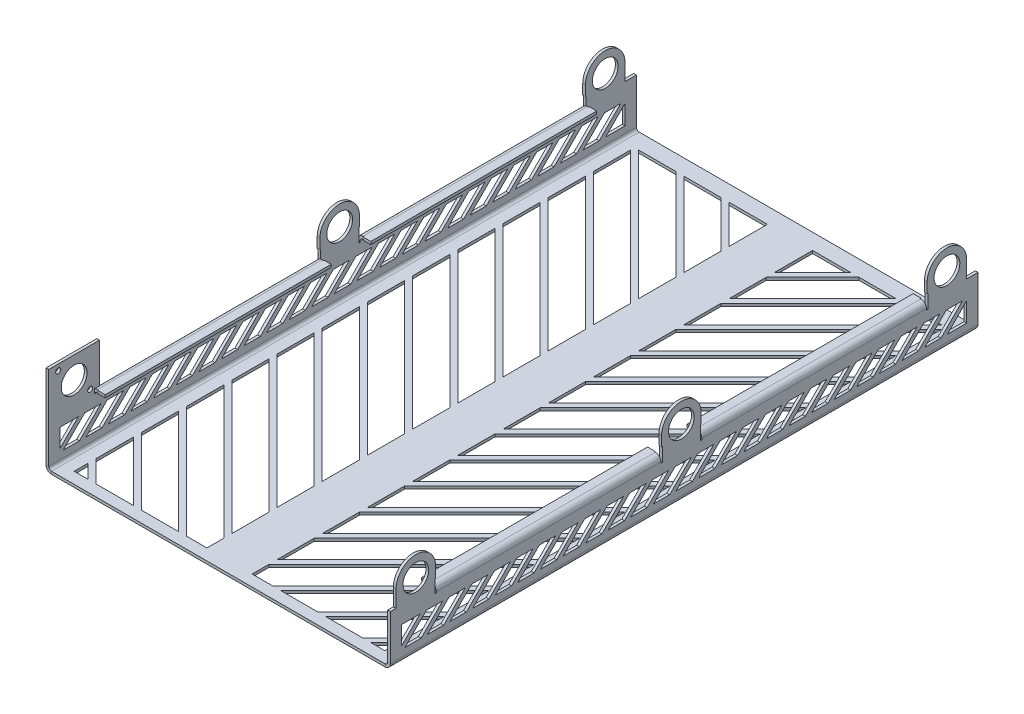
from build123d import *

# Parameters (mm, degrees)
EXTRUDE_THIN1_DEPTH          = 330.2
BOSS_EXTRUDE1_DEPTH          = 3.175
LPATTERN3_COUNT              = 3
LPATTERN3_PITCH              = 298.45
MIRROR5_COPY_1_DEPTH         = 3.175
MIRROR5_COPY_2_DEPTH         = 3.175
CUT_EXTRUDE3_START           = -3.048
SKETCH28_W                   = 380.746
SKETCH28_H                   = 50.8
SKETCH28_H_2                 = 44.45
CUT_EXTRUDE3_DEPTH           = 3.048
F_1_1_8_CLEARANCE_HOLE1_D    = 28.97124
CONVERT_SOLID4_START         = 50.8
CONVERT_SOLID4_DEPTH         = 45.2
CONVERT_SOLID4_2_OUTLINE_W   = 0.127
CONVERT_SOLID4_2_OUTLINE_H   = 44.45
CONVERT_SOLID4_2_OUTLINE_H_2 = 50.8
CONVERT_SOLID4_2_DEPTH       = 1.27312674
CONVERT_SOLID4_START_2       = -330.2
CONVERT_SOLID4_3_DEPTH       = 660.4
CONVERT_SOLID4_START_3       = -273.812
CONVERT_SOLID4_4_DEPTH       = 255.524
CONVERT_SOLID4_START_4       = 24.638
CONVERT_SOLID4_5_DEPTH       = 255.524
CONVERT_SOLID4_6_DEPTH       = 1.524
CONVERT_SOLID4_START_5       = -19.812
CONVERT_SOLID4_7_DEPTH       = 1.524
CONVERT_SOLID4_8_DEPTH       = 1.524
CONVERT_SOLID4_START_6       = 278.638
CONVERT_SOLID4_9_DEPTH       = 1.524
CONVERT_SOLID4_10_DEPTH      = 660.4
CONVERT_SOLID4_START_7       = -272.288
CONVERT_SOLID4_11_DEPTH      = 252.476
CONVERT_SOLID4_START_8       = 26.162
CONVERT_SOLID4_12_DEPTH      = 252.476
VENT1_START                  = -3.048
VENT1_DEPTH                  = 3.048
VENT2_START                  = 190.5
VENT2_DEPTH                  = 3.048
BOSS_EXTRUDE2_START          = -3.048
SKETCH43_W                   = 57.15
SKETCH43_H                   = 57.15
SKETCH43_R                   = 14.48562
BOSS_EXTRUDE2_DEPTH          = 3.048
F_10_CLEARANCE_HOLE1_REACH   = 520.058
F_10_CLEARANCE_HOLE1_BORE_R  = 2.8067


with BuildPart() as part:
    # Sketch13 → Extrude-Thin1 (new, symmetric)
    with BuildSketch(Plane.XY):
        Polygon((-177.8, 50.8), (-190.5, 50.8), (-190.5, 0), (190.5, 0), (190.5, 50.8), (177.8, 50.8), (177.8, 53.848), (193.548, 53.848), (193.548, -3.048), (-193.548, -3.048), (-193.548, 53.848), (-177.8, 53.848), align=None)
    extrude(amount=EXTRUDE_THIN1_DEPTH, both=True)

    # Sketch18 → Boss-Extrude1 (add)
    with BuildSketch(Plane.ZY.offset(193.548)):
        with BuildLine():
            Line((279.4, 53.848), (323.85, 53.848))
            Line((323.85, 53.848), (323.85, 72.898))
            ThreePointArc((323.85, 72.898), (301.625, 95.123), (279.4, 72.898))
            Line((279.4, 72.898), (279.4, 53.848))
        make_face()
    boss_extrude1 = extrude(amount=-BOSS_EXTRUDE1_DEPTH)

    # LPattern3: Boss-Extrude1 ×3
    with Locations(*[(0, 0, -i * LPATTERN3_PITCH) for i in range(1, LPATTERN3_COUNT)]):
        add(boss_extrude1)

    # Mirror5: Boss-Extrude1 across plane
    add(boss_extrude1.mirror(Plane(origin=(0, 0, 0), x_dir=(0, 0, 1), z_dir=(1, 0, 0))))

    # Mirror5 copy 1 sketch → Mirror5 copy 1 (add)
    with BuildSketch(Plane(origin=(193.548, 0, -298.45), x_dir=(0, 0, 1), z_dir=(1, 0, 0))):
        with BuildLine():
            Line((279.4, -53.848), (323.85, -53.848))
            Line((323.85, -53.848), (323.85, -72.898))
            ThreePointArc((323.85, -72.898), (301.625, -95.123), (279.4, -72.898))
            Line((279.4, -72.898), (279.4, -53.848))
        make_face()
    extrude(amount=-MIRROR5_COPY_1_DEPTH)

    # Mirror5 copy 2 sketch → Mirror5 copy 2 (add)
    with BuildSketch(Plane(origin=(193.548, 0, -596.9), x_dir=(0, 0, 1), z_dir=(1, 0, 0))):
        with BuildLine():
            Line((279.4, -53.848), (323.85, -53.848))
            Line((323.85, -53.848), (323.85, -72.898))
            ThreePointArc((323.85, -72.898), (301.625, -95.123), (279.4, -72.898))
            Line((279.4, -72.898), (279.4, -53.848))
        make_face()
    extrude(amount=-MIRROR5_COPY_2_DEPTH)

    # Sketch28 → Cut-Extrude3 (cut)
    with BuildSketch(Plane(origin=(0, 53.848, 0), x_dir=(1, 0, 0), z_dir=(0, 1, 0)).offset(CUT_EXTRUDE3_START)):
        with Locations((0, -304.8)):
            Rectangle(SKETCH28_W, SKETCH28_H)
        with Locations((0, -3.175)):
            Rectangle(SKETCH28_W, SKETCH28_H_2)
        with Locations((0, 295.275)):
            Rectangle(SKETCH28_W, SKETCH28_H_2)
    extrude(amount=CUT_EXTRUDE3_DEPTH, mode=Mode.SUBTRACT)

    # 1-1/8 Clearance Hole1 (through all)
    with Locations(Plane.ZY.offset(193.548)):
        with Locations((301.625, 72.898), (3.175, 72.898), (-295.275, 72.898)):
            Hole(F_1_1_8_CLEARANCE_HOLE1_D / 2)

    # Convert-Solid4: read off the stored shape, not the designer's step
    # Convert-Solid4 outline → Convert-Solid4 (cut)
    with BuildSketch(Plane(origin=(0, 0, 0), x_dir=(1, 0, 0), z_dir=(0, 1, 0)).offset(CONVERT_SOLID4_START)):
        Polygon((-185.801, 19.812), (-190.5, 19.812), (-190.5, -26.162), (-185.801, -26.162), (-185.801, -25.4), (-190.373, -25.4), (-190.373, 19.05), (-185.801, 19.05), align=None)
        Polygon((-190.5, -278.638), (-190.5, -330.2), (-190.373, -330.2), (-190.373, -279.4), (-185.801, -279.4), (-185.801, -278.638), align=None)
        Polygon((190.5, -278.638), (185.801, -278.638), (185.801, -279.4), (190.373, -279.4), (190.373, -330.2), (190.5, -330.2), align=None)
        Polygon((190.5, 19.812), (185.801, 19.812), (185.801, 19.05), (190.373, 19.05), (190.373, -25.4), (185.801, -25.4), (185.801, -26.162), (190.5, -26.162), align=None)
        Polygon((177.8, 330.2), (177.8, 317.5), (190.373, 317.5), (190.373, 273.05), (185.801, 273.05), (185.801, 272.288), (190.5, 272.288), (190.5, 330.2), align=None)
        Polygon((-190.5, 272.288), (-185.801, 272.288), (-185.801, 273.05), (-190.373, 273.05), (-190.373, 317.5), (-177.8, 317.5), (-177.8, 330.2), (-190.5, 330.2), align=None)
    extrude(amount=CONVERT_SOLID4_DEPTH, mode=Mode.SUBTRACT)

    # Convert-Solid4 2 outline → Convert-Solid4 2 (add)
    with BuildSketch(Plane(origin=(0, 0, 0), x_dir=(1, 0, 0), z_dir=(0, 1, 0))):
        with Locations((-190.4365, -3.175)):
            Rectangle(CONVERT_SOLID4_2_OUTLINE_W, CONVERT_SOLID4_2_OUTLINE_H)
        with Locations((-190.4365, -304.8)):
            Rectangle(CONVERT_SOLID4_2_OUTLINE_W, CONVERT_SOLID4_2_OUTLINE_H_2)
        with Locations((190.4365, -3.175)):
            Rectangle(CONVERT_SOLID4_2_OUTLINE_W, CONVERT_SOLID4_2_OUTLINE_H)
        with Locations((190.4365, -304.8)):
            Rectangle(CONVERT_SOLID4_2_OUTLINE_W, CONVERT_SOLID4_2_OUTLINE_H_2)
    extrude(amount=CONVERT_SOLID4_2_DEPTH)

    # Convert-Solid4 3 outline → Convert-Solid4 3 (cut)
    with BuildSketch(Plane.XY.offset(CONVERT_SOLID4_START_2)):
        with BuildLine():
            Line((193.548, -3.048), (193.548, 3.175))
            ThreePointArc((193.548, 3.175), (191.725325499, -1.225325499), (187.325, -3.048))
            Line((187.325, -3.048), (193.548, -3.048))
        make_face()
        with BuildLine():
            ThreePointArc((187.325, 53.848), (188.9711372, 53.626329962), (190.5, 52.977112106))
            Line((190.5, 52.977112106), (190.5, 53.848))
            Line((190.5, 53.848), (187.325, 53.848))
        make_face()
        with BuildLine():
            Line((-193.548, -3.048), (-187.325, -3.048))
            ThreePointArc((-187.325, -3.048), (-191.725325499, -1.225325499), (-193.548, 3.175))
            Line((-193.548, 3.175), (-193.548, -3.048))
        make_face()
        with BuildLine():
            Line((-190.5, 53.848), (-190.5, 52.977112106))
            ThreePointArc((-190.5, 52.977112106), (-188.9711372, 53.626329962), (-187.325, 53.848))
            Line((-187.325, 53.848), (-190.5, 53.848))
        make_face()
    extrude(amount=CONVERT_SOLID4_3_DEPTH, mode=Mode.SUBTRACT)

    # Convert-Solid4 4 outline → Convert-Solid4 4 (cut)
    with BuildSketch(Plane.XY.offset(CONVERT_SOLID4_START_3)):
        with BuildLine():
            ThreePointArc((190.5, 52.977112106), (192.732575889, 50.704586336), (193.548, 47.625))
            Line((193.548, 47.625), (193.548, 61.595))
            Line((193.548, 61.595), (190.5, 61.595))
            Line((190.5, 61.595), (190.5, 52.977112106))
        make_face()
        with BuildLine():
            ThreePointArc((-193.548, 47.625), (-192.732575889, 50.704586336), (-190.5, 52.977112106))
            Line((-190.5, 52.977112106), (-190.5, 61.595))
            Line((-190.5, 61.595), (-193.548, 61.595))
            Line((-193.548, 61.595), (-193.548, 47.625))
        make_face()
    extrude(amount=CONVERT_SOLID4_4_DEPTH, mode=Mode.SUBTRACT)

    # Convert-Solid4 5 outline → Convert-Solid4 5 (cut)
    with BuildSketch(Plane.XY.offset(CONVERT_SOLID4_START_4)):
        with BuildLine():
            ThreePointArc((190.5, 52.977112106), (192.732575889, 50.704586336), (193.548, 47.625))
            Line((193.548, 47.625), (193.548, 61.595))
            Line((193.548, 61.595), (190.5, 61.595))
            Line((190.5, 61.595), (190.5, 52.977112106))
        make_face()
        with BuildLine():
            ThreePointArc((-193.548, 47.625), (-192.732575889, 50.704586336), (-190.5, 52.977112106))
            Line((-190.5, 52.977112106), (-190.5, 61.595))
            Line((-190.5, 61.595), (-193.548, 61.595))
            Line((-193.548, 61.595), (-193.548, 47.625))
        make_face()
    extrude(amount=CONVERT_SOLID4_5_DEPTH, mode=Mode.SUBTRACT)

    # Convert-Solid4 6 outline → Convert-Solid4 6 (cut)
    with BuildSketch(Plane.XY.offset(CONVERT_SOLID4_START_3)):
        with BuildLine():
            Line((190.5, 46.101), (193.548, 46.101))
            Line((193.548, 46.101), (193.548, 47.625))
            ThreePointArc((193.548, 47.625), (192.732575889, 50.704586336), (190.5, 52.977112106))
            Line((190.5, 52.977112106), (190.5, 46.101))
        make_face()
        with BuildLine():
            Line((-193.548, 47.625), (-193.548, 46.101))
            Line((-193.548, 46.101), (-190.5, 46.101))
            Line((-190.5, 46.101), (-190.5, 52.977112106))
            ThreePointArc((-190.5, 52.977112106), (-192.732575889, 50.704586336), (-193.548, 47.625))
        make_face()
    extrude(amount=CONVERT_SOLID4_6_DEPTH, mode=Mode.SUBTRACT)

    # Convert-Solid4 7 outline → Convert-Solid4 7 (cut)
    with BuildSketch(Plane.XY.offset(CONVERT_SOLID4_START_5)):
        with BuildLine():
            Line((190.5, 46.101), (193.548, 46.101))
            Line((193.548, 46.101), (193.548, 47.625))
            ThreePointArc((193.548, 47.625), (192.732575889, 50.704586336), (190.5, 52.977112106))
            Line((190.5, 52.977112106), (190.5, 46.101))
        make_face()
        with BuildLine():
            Line((-193.548, 47.625), (-193.548, 46.101))
            Line((-193.548, 46.101), (-190.5, 46.101))
            Line((-190.5, 46.101), (-190.5, 52.977112106))
            ThreePointArc((-190.5, 52.977112106), (-192.732575889, 50.704586336), (-193.548, 47.625))
        make_face()
    extrude(amount=CONVERT_SOLID4_7_DEPTH, mode=Mode.SUBTRACT)

    # Convert-Solid4 8 outline → Convert-Solid4 8 (cut)
    with BuildSketch(Plane.XY.offset(CONVERT_SOLID4_START_4)):
        with BuildLine():
            Line((190.5, 46.101), (193.548, 46.101))
            Line((193.548, 46.101), (193.548, 47.625))
            ThreePointArc((193.548, 47.625), (192.732575889, 50.704586336), (190.5, 52.977112106))
            Line((190.5, 52.977112106), (190.5, 46.101))
        make_face()
        with BuildLine():
            Line((-193.548, 47.625), (-193.548, 46.101))
            Line((-193.548, 46.101), (-190.5, 46.101))
            Line((-190.5, 46.101), (-190.5, 52.977112106))
            ThreePointArc((-190.5, 52.977112106), (-192.732575889, 50.704586336), (-193.548, 47.625))
        make_face()
    extrude(amount=CONVERT_SOLID4_8_DEPTH, mode=Mode.SUBTRACT)

    # Convert-Solid4 9 outline → Convert-Solid4 9 (cut)
    with BuildSketch(Plane.XY.offset(CONVERT_SOLID4_START_6)):
        with BuildLine():
            Line((190.5, 46.101), (193.548, 46.101))
            Line((193.548, 46.101), (193.548, 47.625))
            ThreePointArc((193.548, 47.625), (192.732575889, 50.704586336), (190.5, 52.977112106))
            Line((190.5, 52.977112106), (190.5, 46.101))
        make_face()
        with BuildLine():
            Line((-193.548, 47.625), (-193.548, 46.101))
            Line((-193.548, 46.101), (-190.5, 46.101))
            Line((-190.5, 46.101), (-190.5, 52.977112106))
            ThreePointArc((-190.5, 52.977112106), (-192.732575889, 50.704586336), (-193.548, 47.625))
        make_face()
    extrude(amount=CONVERT_SOLID4_9_DEPTH, mode=Mode.SUBTRACT)

    # Convert-Solid4 10 outline → Convert-Solid4 10 (add)
    with BuildSketch(Plane.XY.offset(CONVERT_SOLID4_START_2)):
        with BuildLine():
            ThreePointArc((190.5, 3.175), (189.57006403, 0.92993597), (187.325, 0))
            Line((187.325, 0), (190.5, 0))
            Line((190.5, 0), (190.5, 3.175))
        make_face()
        with BuildLine():
            ThreePointArc((-187.325, 0), (-189.57006403, 0.92993597), (-190.5, 3.175))
            Line((-190.5, 3.175), (-190.5, 0))
            Line((-190.5, 0), (-187.325, 0))
        make_face()
    extrude(amount=CONVERT_SOLID4_10_DEPTH)

    # Convert-Solid4 11 outline → Convert-Solid4 11 (add)
    with BuildSketch(Plane.XY.offset(CONVERT_SOLID4_START_7)):
        with BuildLine():
            ThreePointArc((187.325, 50.8), (189.57006403, 49.87006403), (190.5, 47.625))
            Line((190.5, 47.625), (190.5, 50.8))
            Line((190.5, 50.8), (187.325, 50.8))
        make_face()
        with BuildLine():
            Line((-190.5, 50.8), (-190.5, 47.625))
            ThreePointArc((-190.5, 47.625), (-189.57006403, 49.87006403), (-187.325, 50.8))
            Line((-187.325, 50.8), (-190.5, 50.8))
        make_face()
    extrude(amount=CONVERT_SOLID4_11_DEPTH)

    # Convert-Solid4 12 outline → Convert-Solid4 12 (add)
    with BuildSketch(Plane.XY.offset(CONVERT_SOLID4_START_8)):
        with BuildLine():
            ThreePointArc((187.325, 50.8), (189.57006403, 49.87006403), (190.5, 47.625))
            Line((190.5, 47.625), (190.5, 50.8))
            Line((190.5, 50.8), (187.325, 50.8))
        make_face()
        with BuildLine():
            Line((-190.5, 50.8), (-190.5, 47.625))
            ThreePointArc((-190.5, 47.625), (-189.57006403, 49.87006403), (-187.325, 50.8))
            Line((-187.325, 50.8), (-190.5, 50.8))
        make_face()
    extrude(amount=CONVERT_SOLID4_12_DEPTH)

    # Vent1: read off the stored shape, not the designer's step
    # Vent1 outline → Vent1 (cut)
    with BuildSketch(Plane(origin=(0, 0, 0), x_dir=(1, 0, 0), z_dir=(0, 1, 0)).offset(VENT1_START)):
        Polygon((68.534871939, 312.421588084), (25.4, 312.421588084), (25.4, 269.286716144), align=None)
        Polygon((77.515128061, 312.421588084), (25.4, 260.306460023), (25.4, 218.486716144), (119.334871939, 312.421588084), align=None)
        Polygon((128.315128061, 312.421588084), (25.4, 209.506460023), (25.4, 167.686716144), (170.134871939, 312.421588084), align=None)
        Polygon((174.625, 307.931460023), (25.4, 158.706460023), (25.4, 116.886716144), (174.625, 266.111716144), align=None)
        Polygon((174.625, 257.131460023), (25.4, 107.906460023), (25.4, 66.086716144), (174.625, 215.311716144), align=None)
        Polygon((174.625, 206.331460023), (25.4, 57.106460023), (25.4, 15.286716144), (174.625, 164.511716144), align=None)
        Polygon((174.625, 155.531460023), (25.4, 6.306460023), (25.4, -35.513283856), (174.625, 113.711716144), align=None)
        Polygon((174.625, 104.731460023), (25.4, -44.493539977), (25.4, -86.313283856), (174.625, 62.911716144), align=None)
        Polygon((174.625, 53.931460023), (25.4, -95.293539977), (25.4, -137.113283856), (174.625, 12.111716144), align=None)
        Polygon((174.625, 3.131460023), (25.4, -146.093539977), (25.4, -187.913283856), (174.625, -38.688283856), align=None)
        Polygon((174.625, -47.668539977), (25.4, -196.893539977), (25.4, -238.713283856), (174.625, -89.488283856), align=None)
        Polygon((174.625, -98.468539977), (25.4, -247.693539977), (25.4, -289.513283856), (174.625, -140.288283856), align=None)
        Polygon((174.625, -149.268539977), (25.4, -298.493539977), (25.4, -317.5), (48.213283856, -317.5), (174.625, -191.088283856), align=None)
        Polygon((99.013283856, -317.5), (174.625, -241.888283856), (174.625, -200.068539977), (57.193539977, -317.5), align=None)
        Polygon((149.813283856, -317.5), (174.625, -292.688283856), (174.625, -250.868539977), (107.993539977, -317.5), align=None)
        Polygon((158.793539977, -317.5), (174.625, -317.5), (174.625, -301.668539977), align=None)
    vent1 = extrude(amount=VENT1_DEPTH, mode=Mode.SUBTRACT)

    # Mirror7: Vent1 across plane
    add(vent1.mirror(Plane(origin=(0, 0, 0), x_dir=(0, 0, 1), z_dir=(1, 0, 0))), mode=Mode.SUBTRACT)

    # Vent2: read off the stored shape, not the designer's step
    # Vent2 outline → Vent2 (cut)
    with BuildSketch(Plane.YZ.offset(VENT2_START)):
        Polygon((34.925, 296.962102448), (34.925, 317.5), (14.387102448, 317.5), align=None)
        Polygon((34.925, 271.562102448), (34.925, 289.777897552), (10.795, 313.907897552), (10.795, 295.692102448), align=None)
        Polygon((34.925, 246.162102448), (34.925, 264.377897552), (10.795, 288.507897552), (10.795, 270.292102448), align=None)
        Polygon((34.925, 220.762102448), (34.925, 238.977897552), (10.795, 263.107897552), (10.795, 244.892102448), align=None)
        Polygon((34.925, 195.362102448), (34.925, 213.577897552), (10.795, 237.707897552), (10.795, 219.492102448), align=None)
        Polygon((34.925, 169.962102448), (34.925, 188.177897552), (10.795, 212.307897552), (10.795, 194.092102448), align=None)
        Polygon((34.925, 144.562102448), (34.925, 162.777897552), (10.795, 186.907897552), (10.795, 168.692102448), align=None)
        Polygon((34.925, 119.162102448), (34.925, 137.377897552), (10.795, 161.507897552), (10.795, 143.292102448), align=None)
        Polygon((34.925, 93.762102448), (34.925, 111.977897552), (10.795, 136.107897552), (10.795, 117.892102448), align=None)
        Polygon((34.925, 68.362102448), (34.925, 86.577897552), (10.795, 110.707897552), (10.795, 92.492102448), align=None)
        Polygon((34.925, 42.962102448), (34.925, 61.177897552), (10.795, 85.307897552), (10.795, 67.092102448), align=None)
        Polygon((34.925, 17.562102448), (34.925, 35.777897552), (10.795, 59.907897552), (10.795, 41.692102448), align=None)
        Polygon((34.925, -7.837897552), (34.925, 10.377897552), (10.795, 34.507897552), (10.795, 16.292102448), align=None)
        Polygon((34.925, -33.237897552), (34.925, -15.022102448), (10.795, 9.107897552), (10.795, -9.107897552), align=None)
        Polygon((34.925, -58.637897552), (34.925, -40.422102448), (10.795, -16.292102448), (10.795, -34.507897552), align=None)
        Polygon((34.925, -84.037897552), (34.925, -65.822102448), (10.795, -41.692102448), (10.795, -59.907897552), align=None)
        Polygon((34.925, -109.437897552), (34.925, -91.222102448), (10.795, -67.092102448), (10.795, -85.307897552), align=None)
        Polygon((34.925, -134.837897552), (34.925, -116.622102448), (10.795, -92.492102448), (10.795, -110.707897552), align=None)
        Polygon((34.925, -160.237897552), (34.925, -142.022102448), (10.795, -117.892102448), (10.795, -136.107897552), align=None)
        Polygon((34.925, -185.637897552), (34.925, -167.422102448), (10.795, -143.292102448), (10.795, -161.507897552), align=None)
        Polygon((34.925, -211.037897552), (34.925, -192.822102448), (10.795, -168.692102448), (10.795, -186.907897552), align=None)
        Polygon((34.925, -236.437897552), (34.925, -218.222102448), (10.795, -194.092102448), (10.795, -212.307897552), align=None)
        Polygon((34.925, -261.837897552), (34.925, -243.622102448), (10.795, -219.492102448), (10.795, -237.707897552), align=None)
        Polygon((34.925, -287.237897552), (34.925, -269.022102448), (10.795, -244.892102448), (10.795, -263.107897552), align=None)
        Polygon((34.925, -312.637897552), (34.925, -294.422102448), (10.795, -270.292102448), (10.795, -288.507897552), align=None)
        Polygon((10.795, -295.692102448), (10.795, -317.5), (32.602897552, -317.5), align=None)
    vent2 = extrude(amount=VENT2_DEPTH, mode=Mode.SUBTRACT)

    # Mirror8: Vent2 across plane
    add(vent2.mirror(Plane(origin=(0, 0, 0), x_dir=(0, 0, 1), z_dir=(1, 0, 0))), mode=Mode.SUBTRACT)

    # Sketch43 → Boss-Extrude2 (add)
    with BuildSketch(Plane.ZY.offset(193.548).offset(BOSS_EXTRUDE2_START)):
        with Locations((301.625, 68.935328861)):
            Rectangle(SKETCH43_W, SKETCH43_H)
        with Locations((301.625, 72.898)):
            Circle(SKETCH43_R, mode=Mode.SUBTRACT)
    extrude(amount=BOSS_EXTRUDE2_DEPTH)

    # #10 Clearance Hole1 bore → #10 Clearance Hole1 (cut, up to next)
    with BuildSketch(Plane.ZY.offset(193.548), mode=Mode.PRIVATE) as f_10_clearance_hole1_sk1:
        with Locations((319.585512242, 90.858512242)):
            Circle(F_10_CLEARANCE_HOLE1_BORE_R)
    f_10_clearance_hole1_tool1 = extrude(f_10_clearance_hole1_sk1.sketch, amount=-F_10_CLEARANCE_HOLE1_REACH, mode=Mode.PRIVATE) & part.part
    # #10 Clearance Hole1 bore → #10 Clearance Hole1 (cut, up to next)
    with BuildSketch(Plane.ZY.offset(193.548), mode=Mode.PRIVATE) as f_10_clearance_hole1_sk2:
        with Locations((283.664487758, 54.937487758)):
            Circle(F_10_CLEARANCE_HOLE1_BORE_R)
    f_10_clearance_hole1_tool2 = extrude(f_10_clearance_hole1_sk2.sketch, amount=-F_10_CLEARANCE_HOLE1_REACH, mode=Mode.PRIVATE) & part.part
    add(f_10_clearance_hole1_tool1.solids().sort_by_distance((-193.548, 90.858512, 319.585512))[0], mode=Mode.SUBTRACT)
    add(f_10_clearance_hole1_tool2.solids().sort_by_distance((-193.548, 54.937488, 283.664488))[0], mode=Mode.SUBTRACT)


solid = part.part
